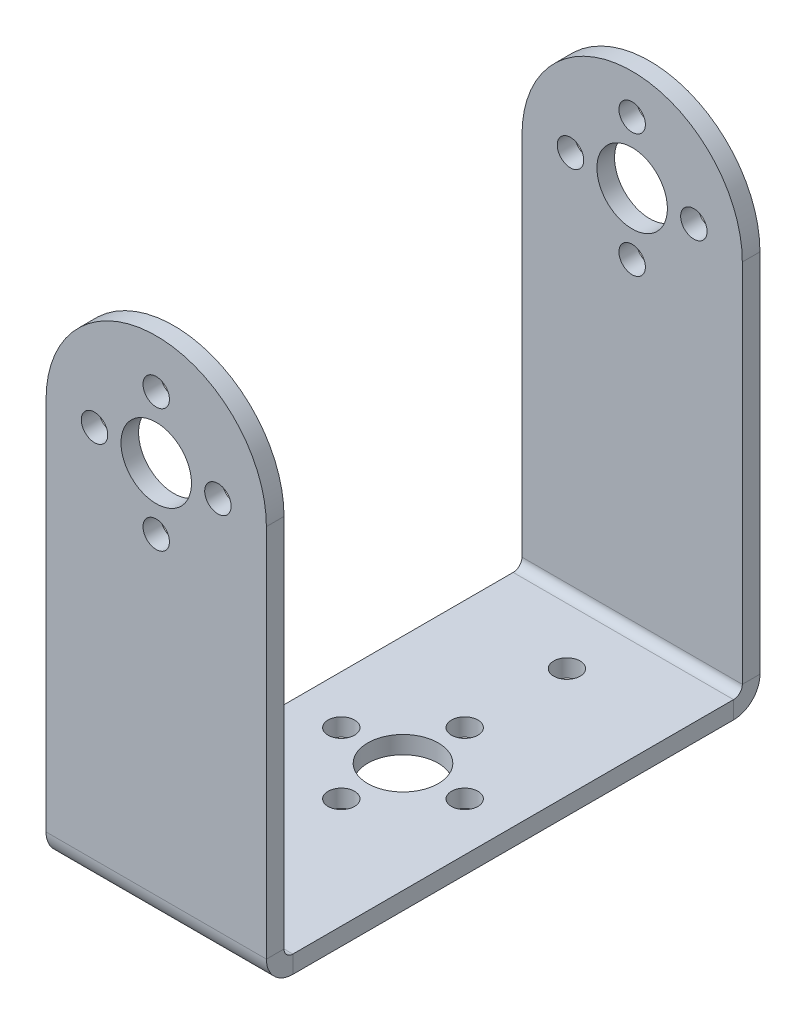
from build123d import *

# Parameters (mm, degrees)
BASE_FLANGE1_DEPTH           = 2
EDGE_FLANGE1_DEPTH           = 25
EDGE_FLANGE2_STRIP_W         = 10
EDGE_FLANGE2_STRIP_H         = 2
EDGE_FLANGE2_STRIP_CUT_DEPTH = 25
EDGE_FLANGE2_DEPTH           = 25
CUT_EXTRUDE1_DEPTH           = 2
SKETCH19_R                   = 4
CUT_EXTRUDE2_DEPTH           = 80.481129836
M3X0_5_TAPPED_HOLE1_D        = 3
SKETCH22_R                   = 4
CUT_EXTRUDE3_DEPTH           = 81.176368089
M3X0_5_TAPPED_HOLE2_D        = 3


# Sheet-metal steps are written as plain solids
with BuildPart() as part:
    # Sketch8 → Base-Flange1 (new body)
    with BuildSketch(Plane.XY):
        with BuildLine():
            Line((-12.5, 0), (12.5, 0))
            Line((12.5, 0), (12.5, 42.5))
            ThreePointArc((12.5, 42.5), (0, 55), (-12.5, 42.5))
            Line((-12.5, 42.5), (-12.5, 0))
        make_face()
    extrude(amount=-BASE_FLANGE1_DEPTH)

    # Edge-Flange1 section (across the edge) → Edge-Flange1 (add)
    with BuildSketch(Plane(origin=(12.5, -1, -2), x_dir=(0, 1, 0), z_dir=(-1, 0, 0))):
        with BuildLine():
            Line((-2, 1), (-2, 52))
            Line((-2, 52), (0, 52))
            Line((0, 52), (0, 1))
            ThreePointArc((0, 1), (0.292893219, 0.292893219), (1, 0))
            Line((1, 0), (1, -2))
            ThreePointArc((1, -2), (-1.121320344, -1.121320344), (-2, 1))
        make_face()
    extrude(amount=EDGE_FLANGE1_DEPTH)

    # Edge-Flange2 strip (across the edge) → Edge-Flange2 strip cut (cut)
    with BuildSketch(Plane(origin=(12.5, -1, -54), x_dir=(0, 0, 1), z_dir=(-1, 0, 0))):
        with Locations((-4, -1)):
            Rectangle(EDGE_FLANGE2_STRIP_W, EDGE_FLANGE2_STRIP_H)
    extrude(amount=EDGE_FLANGE2_STRIP_CUT_DEPTH, mode=Mode.SUBTRACT)

    # Edge-Flange2 section (across the edge) → Edge-Flange2 (add)
    with BuildSketch(Plane(origin=(12.5, -1, -54), x_dir=(0, 0, 1), z_dir=(-1, 0, 0))):
        with BuildLine():
            Line((-2, 1), (-2, 55))
            Line((-2, 55), (0, 55))
            Line((0, 55), (0, 1))
            ThreePointArc((0, 1), (0.292893219, 0.292893219), (1, 0))
            Line((1, 0), (1, -2))
            ThreePointArc((1, -2), (-1.121320344, -1.121320344), (-2, 1))
        make_face()
    extrude(amount=EDGE_FLANGE2_DEPTH)

    # Sketch18 → Cut-Extrude1 (cut)
    with BuildSketch(Plane(origin=(0, 0, -56), x_dir=(-1, 0, 0), z_dir=(0, 0, -1))):
        with BuildLine():
            ThreePointArc((0, 54), (8.838834765, 50.338834765), (12.5, 41.5))
            Line((12.5, 41.5), (12.5, 54))
            Line((12.5, 54), (0, 54))
        make_face()
        with BuildLine():
            ThreePointArc((-12.5, 41.5), (-8.838834765, 50.338834765), (0, 54))
            Line((0, 54), (-12.5, 54))
            Line((-12.5, 54), (-12.5, 41.5))
        make_face()
    extrude(amount=-CUT_EXTRUDE1_DEPTH, mode=Mode.SUBTRACT)

    # Sketch19 → Cut-Extrude2 (cut, through all)
    with BuildSketch(Plane.XY):
        with Locations((0, 42.5)):
            Circle(SKETCH19_R)
    extrude(amount=-CUT_EXTRUDE2_DEPTH, mode=Mode.SUBTRACT)

    # M3x0.5 Tapped Hole1 (through all)
    with Locations(Plane.XY):
        with Locations((0, 49.5), (-7, 42.5), (0, 35.5), (7, 42.5)):
            Hole(M3X0_5_TAPPED_HOLE1_D / 2)

    # Sketch22 → Cut-Extrude3 (cut, through all)
    with BuildSketch(Plane(origin=(0, -1, 0), x_dir=(1, 0, 0), z_dir=(0, 1, 0))):
        with Locations(Location((0, 28, 0), (0, 0, 270))):
            Circle(SKETCH22_R)
    extrude(amount=-CUT_EXTRUDE3_DEPTH, mode=Mode.SUBTRACT)

    # M3x0.5 Tapped Hole2 (through all)
    with Locations(Plane(origin=(0, -1, 0), x_dir=(1, 0, 0), z_dir=(0, 1, 0))):
        with Locations((7, 28), (-7, 28), (0, 35), (0, 21), (0, 9.4), (0, 46.6)):
            Hole(M3X0_5_TAPPED_HOLE2_D / 2)


solid = part.part
